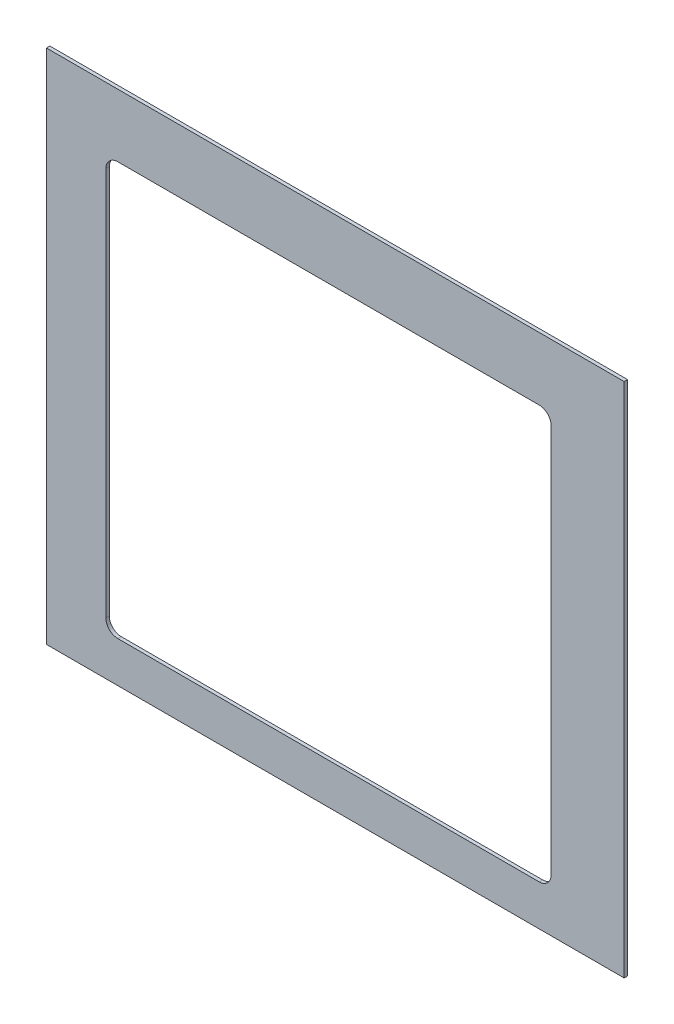
from build123d import *

# Parameters (mm, degrees)
SKETCH1_W           = 340
SKETCH1_H           = 304
BOSS_EXTRUDE1_DEPTH = 2


with BuildPart() as part:
    # Sketch1 → Boss-Extrude1 (new body)
    with BuildSketch(Plane.XY):
        Rectangle(SKETCH1_W, SKETCH1_H)
        with BuildLine():
            ThreePointArc((127, -121), (124.949747468, -125.949747468), (120, -128))
            Line((120, -128), (-128, -128))
            ThreePointArc((-128, -128), (-132.949747468, -125.949747468), (-135, -121))
            Line((-135, -121), (-135, 108))
            ThreePointArc((-135, 108), (-132.949747468, 112.949747468), (-128, 115))
            Line((-128, 115), (120, 115))
            ThreePointArc((120, 115), (124.949747468, 112.949747468), (127, 108))
            Line((127, 108), (127, -121))
        make_face(mode=Mode.SUBTRACT)
    extrude(amount=BOSS_EXTRUDE1_DEPTH)


solid = part.part
